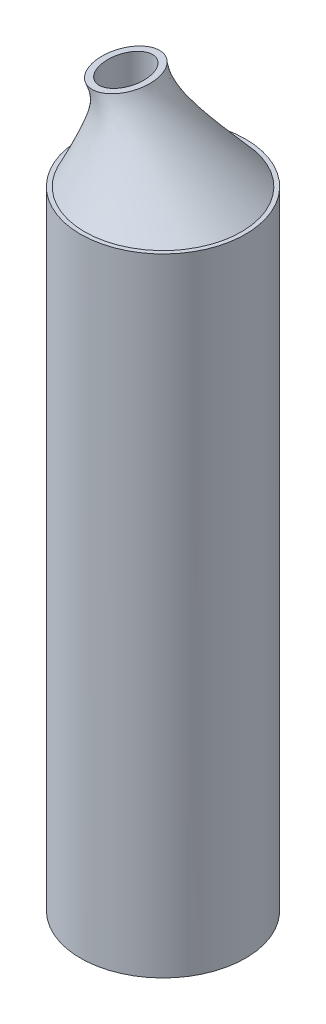
from build123d import *

# Parameters (mm, degrees)
SKETCH1_R           = 20
SKETCH1_R_2         = 19
BOSS_EXTRUDE1_DEPTH = 150
SKETCH7_RX          = 6.473584377
SKETCH7_RY          = 4.356630244
CUT_EXTRUDE3_DEPTH  = 173.336879396
BOSS_EXTRUDE3_START = 2
SKETCH9_R           = 20
BOSS_EXTRUDE3_DEPTH = 2
SKETCH10_R          = 5
CUT_EXTRUDE5_DEPTH  = 2
SKETCH11_R          = 19
SKETCH11_R_2        = 12.5
BOSS_EXTRUDE4_DEPTH = 5
SKETCH12_R          = 19
SKETCH12_R_2        = 12.5
BOSS_EXTRUDE5_DEPTH = 5


with BuildPart() as part:
    # Sketch1 → Boss-Extrude1 (new body)
    with BuildSketch(Plane(origin=(0, 0, 0), x_dir=(1, 0, 0), z_dir=(0, 1, 0))):
        with Locations(Location((0, 0, 0), (0, 0, 270))):
            Circle(SKETCH1_R)
        with Locations(Location((0, 0, 0), (0, 0, 270))):
            Circle(SKETCH1_R_2, mode=Mode.SUBTRACT)
    extrude(amount=BOSS_EXTRUDE1_DEPTH)

    # Sketch9 → Boss-Extrude3 (add)
    with BuildSketch(Plane.XZ.offset(BOSS_EXTRUDE3_START)):
        with Locations(Location((0, 0, 0), (0, 0, 270))):
            Circle(SKETCH9_R)
    extrude(amount=-BOSS_EXTRUDE3_DEPTH)

    # Sketch10 → Cut-Extrude5 (cut)
    with BuildSketch(Plane.XZ.offset(2)):
        with Locations(Location((0, 0, 0), (0, 0, 270))):
            Circle(SKETCH10_R)
        with Locations(Location((-1.293672519, 12.432876233, 0), (0, 0, 270))):
            Circle(SKETCH10_R)
        with Locations(Location((11.130848453, 5.688076363, 0), (0, 0, 270))):
            Circle(SKETCH10_R)
        with Locations(Location((9.317782084, -8.332402837, 0), (0, 0, 270))):
            Circle(SKETCH10_R)
        with Locations(Location((-5.457980639, -11.245463412, 0), (0, 0, 270))):
            Circle(SKETCH10_R)
        with Locations(Location((-12.311057922, 2.165144991, 0), (0, 0, 270))):
            Circle(SKETCH10_R)
    extrude(amount=-CUT_EXTRUDE5_DEPTH, mode=Mode.SUBTRACT)

    # Sketch11 → Boss-Extrude4 (add)
    with BuildSketch(Plane(origin=(0, 35, 0), x_dir=(1, 0, 0), z_dir=(0, 1, 0))):
        with Locations(Location((0, 0, 0), (0, 0, 270))):
            Circle(SKETCH11_R)
        with Locations(Location((0, 0, 0), (0, 0, 270))):
            Circle(SKETCH11_R_2, mode=Mode.SUBTRACT)
    extrude(amount=BOSS_EXTRUDE4_DEPTH)

    # Sketch12 → Boss-Extrude5 (add)
    with BuildSketch(Plane(origin=(0, 100, 0), x_dir=(1, 0, 0), z_dir=(0, 1, 0))):
        with Locations(Location((0, 0, 0), (0, 0, 270))):
            Circle(SKETCH12_R)
        with Locations(Location((0, 0, 0), (0, 0, 270))):
            Circle(SKETCH12_R_2, mode=Mode.SUBTRACT)
    extrude(amount=BOSS_EXTRUDE5_DEPTH)


with BuildPart() as body_2:
    # Loft1: read off the stored shape, not the designer's step
    # Loft1: loft between two sections, ruled curve by curve
    loft1_from = [
        Edge.make_bspline([(-17.691995775, 150, -6.927718635), (-31.547433046, 150, 28.456272915), (3.836558504, 150, 42.311710186), (17.691995775, 150, 6.927718635), (31.547433046, 150, -28.456272915), (-3.836558504, 150, -42.311710186), (-17.691995775, 150, -6.927718635)], [0, 0, 0, 0, 0.5, 0.5, 0.5, 1, 1, 1, 1], 3, [1, 0.333333333, 0.333333333, 1, 0.333333333, 0.333333333, 1]),
    ]
    loft1_to = [
        Edge.make_bspline([(-8.805610447, 170, -8.186057952), (-20.364084354, 170, -8.793591776), (-20.792994332, 170, 7.578524127), (-9.234520424, 170, 8.186057952), (2.323953483, 170, 8.793591776), (2.75286346, 170, -7.578524127), (-8.805610447, 170, -8.186057952)], [0, 0, 0, 0, 0.5, 0.5, 0.5, 1, 1, 1, 1], 3, [1, 0.333333333, 0.333333333, 1, 0.333333333, 0.333333333, 1]),
    ]
    loft1 = Solid(Shell([*[Face.make_surface_from_curves(loft1_from[k], loft1_to[k]) for k in range(1)], Face(Wire(loft1_from)), Face(Wire(loft1_to))]))
    add(loft1)

    # Sketch7 → Cut-Extrude3 (cut, through all)
    with BuildSketch(Plane(origin=(0, 170, 0), x_dir=(1, 0, 0), z_dir=(0, 1, 0))):
        with Locations(Location((-9.020065436, 0), (0, 0, 90))):
            Ellipse(SKETCH7_RX, SKETCH7_RY)
    extrude(amount=-CUT_EXTRUDE3_DEPTH, mode=Mode.SUBTRACT)


solid = Compound([part.part, body_2.part])
